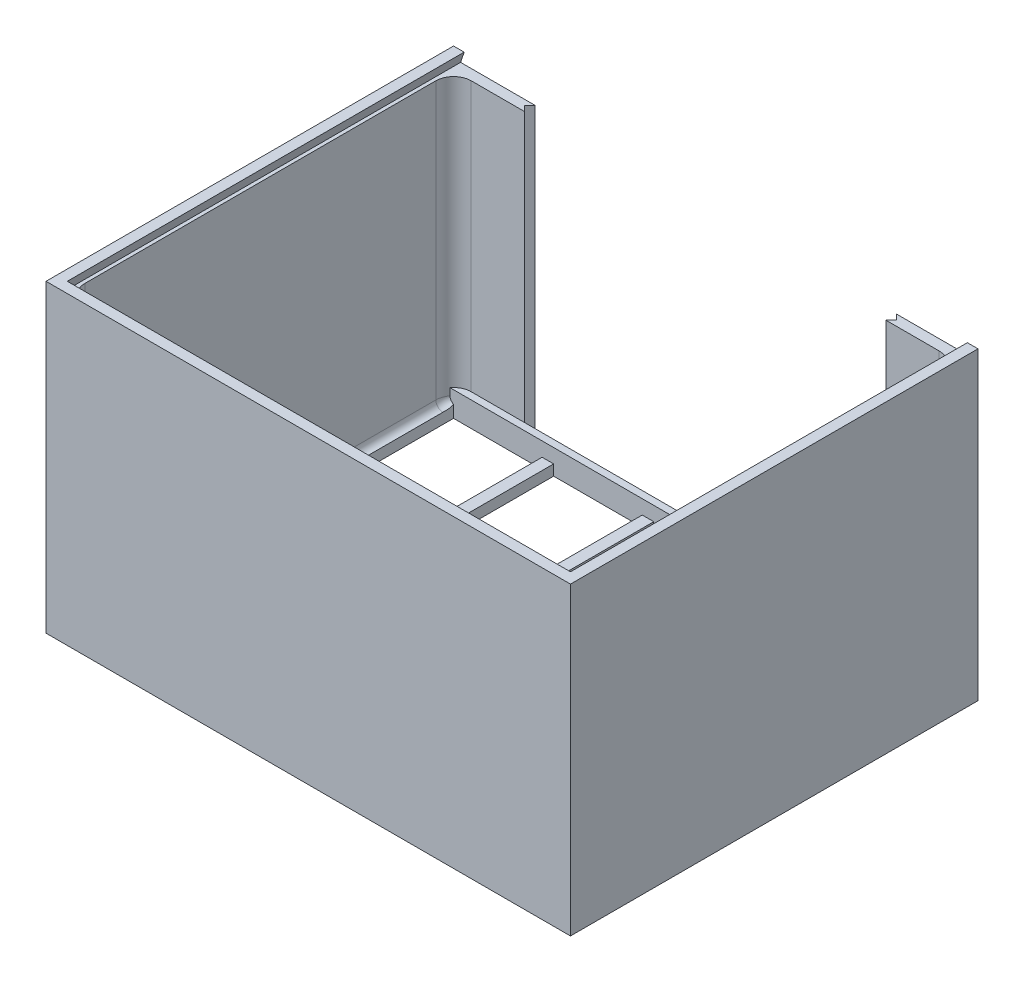
from build123d import *

# Parameters (mm, degrees)
SKETCH1_W                = 148
SKETCH1_H                = 115
SKETCH1_W_2              = 25
SKETCH1_H_2              = 24
BOSS_EXTRUDE2_DEPTH      = 3
BOSS_EXTRUDE3_DEPTH      = 80
SKETCH21_W               = 142
SKETCH21_H               = 2
BOSS_EXTRUDE9_DEPTH      = 4
BOSS_EXTRUDE7_DEPTH      = 8
BOSS_EXTRUDE7_DEPTH_BACK = 3
BOSS_EXTRUDE8_DEPTH      = 3
CUT_EXTRUDE1_DEPTH       = 112
FILLET1_R                = 5
FILLET2_R                = 2


with BuildPart() as part:
    # Sketch1 → Boss-Extrude2 (new body)
    with BuildSketch(Plane(origin=(0, 0, 0), x_dir=(1, 0, 0), z_dir=(0, 1, 0))):
        with Locations((69, 52.5)):
            Rectangle(SKETCH1_W, SKETCH1_H)
        with Locations((12.5, 66)):
            Rectangle(SKETCH1_W_2, SKETCH1_H_2, mode=Mode.SUBTRACT)
        with Locations((12.5, 39)):
            Rectangle(SKETCH1_W_2, SKETCH1_H_2, mode=Mode.SUBTRACT)
        with Locations((40.75, 66)):
            Rectangle(SKETCH1_W_2, SKETCH1_H_2, mode=Mode.SUBTRACT)
        with Locations((40.75, 39)):
            Rectangle(SKETCH1_W_2, SKETCH1_H_2, mode=Mode.SUBTRACT)
        with Locations((12.5, 12)):
            Rectangle(SKETCH1_W_2, SKETCH1_H_2, mode=Mode.SUBTRACT)
        with Locations((12.5, 93)):
            Rectangle(SKETCH1_W_2, SKETCH1_H_2, mode=Mode.SUBTRACT)
        with Locations((40.75, 12)):
            Rectangle(SKETCH1_W_2, SKETCH1_H_2, mode=Mode.SUBTRACT)
        with Locations((40.75, 93)):
            Rectangle(SKETCH1_W_2, SKETCH1_H_2, mode=Mode.SUBTRACT)
        with Locations((69, 66)):
            Rectangle(SKETCH1_W_2, SKETCH1_H_2, mode=Mode.SUBTRACT)
        with Locations((69, 39)):
            Rectangle(SKETCH1_W_2, SKETCH1_H_2, mode=Mode.SUBTRACT)
        with Locations((69, 12)):
            Rectangle(SKETCH1_W_2, SKETCH1_H_2, mode=Mode.SUBTRACT)
        with Locations((69, 93)):
            Rectangle(SKETCH1_W_2, SKETCH1_H_2, mode=Mode.SUBTRACT)
        with Locations((97.25, 66)):
            Rectangle(SKETCH1_W_2, SKETCH1_H_2, mode=Mode.SUBTRACT)
        with Locations((97.25, 39)):
            Rectangle(SKETCH1_W_2, SKETCH1_H_2, mode=Mode.SUBTRACT)
        with Locations((97.25, 12)):
            Rectangle(SKETCH1_W_2, SKETCH1_H_2, mode=Mode.SUBTRACT)
        with Locations((97.25, 93)):
            Rectangle(SKETCH1_W_2, SKETCH1_H_2, mode=Mode.SUBTRACT)
        with Locations((125.5, 66)):
            Rectangle(SKETCH1_W_2, SKETCH1_H_2, mode=Mode.SUBTRACT)
        with Locations((125.5, 39)):
            Rectangle(SKETCH1_W_2, SKETCH1_H_2, mode=Mode.SUBTRACT)
        with Locations((125.5, 12)):
            Rectangle(SKETCH1_W_2, SKETCH1_H_2, mode=Mode.SUBTRACT)
        with Locations((125.5, 93)):
            Rectangle(SKETCH1_W_2, SKETCH1_H_2, mode=Mode.SUBTRACT)
    extrude(amount=BOSS_EXTRUDE2_DEPTH)

    # Sketch4 → Boss-Extrude3 (add)
    with BuildSketch(Plane(origin=(0, 3, 0), x_dir=(1, 0, 0), z_dir=(0, 1, 0))):
        Polygon((-5, -5), (143, -5), (143, 110), (120, 110), (121.5, 108.5), (120, 107), (140, 107), (140, -2), (-2, -2), (-2, 107), (18, 107), (16.5, 108.5), (18, 110), (-5, 110), align=None)
    extrude(amount=BOSS_EXTRUDE3_DEPTH)

    # Sketch21 → Boss-Extrude9 (add)
    with BuildSketch(Plane(origin=(0, 3, 0), x_dir=(1, 0, 0), z_dir=(0, 1, 0))):
        with Locations((69, 106)):
            Rectangle(SKETCH21_W, SKETCH21_H)
    extrude(amount=BOSS_EXTRUDE9_DEPTH)

    # Sketch16 → Boss-Extrude7 (add, two sides: drawn at the far end of the back side and taken through both)
    with BuildSketch(Plane(origin=(0, 3, 0), x_dir=(1, 0, 0), z_dir=(0, 1, 0)).offset(-BOSS_EXTRUDE7_DEPTH_BACK)):
        with BuildLine():
            Line((5.5, 42), (-2, 42))
            Line((-2, 42), (-2, 38))
            Line((-2, 38), (5.5, 38))
            ThreePointArc((5.5, 38), (7.5, 40), (5.5, 42))
        make_face()
        with BuildLine():
            Line((140, 38), (132.5, 38))
            ThreePointArc((132.5, 38), (130.5, 40), (132.5, 42))
            Line((132.5, 42), (140, 42))
            Line((140, 42), (140, 38))
        make_face()
    extrude(amount=BOSS_EXTRUDE7_DEPTH + BOSS_EXTRUDE7_DEPTH_BACK)

    # Sketch17 → Boss-Extrude8 (add)
    with BuildSketch(Plane(origin=(0, 83, 0), x_dir=(1, 0, 0), z_dir=(0, 1, 0))):
        Polygon((-2, 110), (-5, 110), (-5, -5), (143, -5), (143, 110), (140, 110), (140, -2), (-2, -2), align=None)
    extrude(amount=BOSS_EXTRUDE8_DEPTH)

    # Sketch18 → Cut-Extrude1 (cut)
    with BuildSketch(Plane(origin=(0, 0, -110), x_dir=(-1, 0, 0), z_dir=(0, 0, -1))):
        Polygon((2, 86), (3, 83), (2, 83), align=None)
        Polygon((-140, 83), (-140, 86), (-141, 83), align=None)
    extrude(amount=-CUT_EXTRUDE1_DEPTH, mode=Mode.SUBTRACT)

    # Fillet1
    # the kernel refuses this fillet: 5 mm, written as the material it adds along each edge
    with BuildSketch(Plane(origin=(140, -5.5, -107), x_dir=(-1, 0, 0), z_dir=(0, 1, 0))) as fillet1_piece_1_section:
        with BuildLine():
            CenterArc((FILLET1_R, FILLET1_R), FILLET1_R, 180, 90)
            Line((0, FILLET1_R), (0, 0))
            Line((0, 0), (FILLET1_R, 0))
        make_face()
    fillet1_piece_1 = extrude(amount=88.5, mode=Mode.PRIVATE)
    fillet1_piece_1 = split(fillet1_piece_1, bisect_by=Plane(origin=(139.705950561, 3, -104.265828048), z_dir=(0, 1, 0)), keep=Keep.TOP, mode=Mode.PRIVATE)
    add(fillet1_piece_1)
    with BuildSketch(Plane(origin=(-2, -5.5, -107), x_dir=(0, 0, 1), z_dir=(0, 1, 0))) as fillet1_piece_2_section:
        with BuildLine():
            CenterArc((FILLET1_R, FILLET1_R), FILLET1_R, 180, 90)
            Line((0, FILLET1_R), (0, 0))
            Line((0, 0), (FILLET1_R, 0))
        make_face()
    fillet1_piece_2 = extrude(amount=88.5, mode=Mode.PRIVATE)
    fillet1_piece_2 = split(fillet1_piece_2, bisect_by=Plane(origin=(-1.705950561, 3, -104.265828048), z_dir=(0, 1, 0)), keep=Keep.TOP, mode=Mode.PRIVATE)
    add(fillet1_piece_2)
    with BuildSketch(Plane(origin=(140, 3, 2), x_dir=(-1, 0, 0), z_dir=(0, 1, 0)), Plane(origin=(-2, 3, 2), x_dir=(0, 0, -1), z_dir=(0, 1, 0))) as fillet1_piece_3:
        with BuildLine():
            CenterArc((FILLET1_R, -FILLET1_R), FILLET1_R, 90, 90)
            Line((0, -FILLET1_R), (0, 0))
            Line((0, 0), (FILLET1_R, 0))
        make_face()
    extrude(amount=80)

    # Fillet2
    # the kernel refuses this fillet: 2 mm, written as the material it adds along each edge
    with BuildSketch(Plane(origin=(135, 3, -102), x_dir=(-0.07270796920191176, 0, -0.9973532730254281), z_dir=(-0.9973532730254281, 0, 0.07270796920191176))) as fillet2_piece_1_section:
        with BuildLine():
            CenterArc((5 - FILLET2_R, -FILLET2_R), FILLET2_R, 0, 90)
            Line((5 - FILLET2_R, 0), (5, 0))
            Line((5, 0), (5, -FILLET2_R))
        make_face()
    fillet2_piece_1 = revolve(axis=Axis((135, 3, -102), (0, -1, 0)), revolution_arc=94.169538965, mode=Mode.PRIVATE)
    fillet2_piece_1 = split(fillet2_piece_1, bisect_by=Plane(origin=(138, 3.470530123, -106.266382325), z_dir=(-1, 0, 0)), keep=Keep.TOP, mode=Mode.PRIVATE)
    fillet2_piece_1 = split(fillet2_piece_1, bisect_by=Plane(origin=(136.35715758, 3.470530123, -105), z_dir=(0, 0, -1)), keep=Keep.TOP, mode=Mode.PRIVATE)
    add(fillet2_piece_1)
    with BuildSketch(Plane(origin=(135, 3, -102), x_dir=(-0.07270796920191176, 0, -0.9973532730254281), z_dir=(-0.9973532730254281, 0, 0.07270796920191176))) as fillet2_piece_2_section:
        with BuildLine():
            CenterArc((5 - FILLET2_R, -FILLET2_R), FILLET2_R, 0, 90)
            Line((5 - FILLET2_R, 0), (5, 0))
            Line((5, 0), (5, -FILLET2_R))
        make_face()
    fillet2_piece_2 = revolve(axis=Axis((135, 3, -102), (0, -1, 0)), revolution_arc=94.169538965, mode=Mode.PRIVATE)
    fillet2_piece_2 = split(fillet2_piece_2, bisect_by=Plane(origin=(138, 3.649157182, -105.409619708), z_dir=(1, 0, 0)), keep=Keep.TOP, mode=Mode.PRIVATE)
    fillet2_piece_2 = split(fillet2_piece_2, bisect_by=Plane(origin=(138.409619683, 3.649157182, -105), z_dir=(0, 0, -1)), keep=Keep.TOP, mode=Mode.PRIVATE)
    add(fillet2_piece_2)
    with BuildSketch(Plane(origin=(135, 3, -102), x_dir=(-0.07270796920191176, 0, -0.9973532730254281), z_dir=(-0.9973532730254281, 0, 0.07270796920191176))) as fillet2_piece_3_section:
        with BuildLine():
            CenterArc((5 - FILLET2_R, -FILLET2_R), FILLET2_R, 0, 90)
            Line((5 - FILLET2_R, 0), (5, 0))
            Line((5, 0), (5, -FILLET2_R))
        make_face()
    fillet2_piece_3 = revolve(axis=Axis((135, 3, -102), (0, -1, 0)), revolution_arc=94.169538965, mode=Mode.PRIVATE)
    fillet2_piece_3 = split(fillet2_piece_3, bisect_by=Plane(origin=(138, 3.469844762, -103.519186596), z_dir=(1, 0, 0)), keep=Keep.TOP, mode=Mode.PRIVATE)
    fillet2_piece_3 = split(fillet2_piece_3, bisect_by=Plane(origin=(139.232598195, 3.469844762, -105), z_dir=(0, 0, 1)), keep=Keep.TOP, mode=Mode.PRIVATE)
    add(fillet2_piece_3)
    with BuildSketch(Plane(origin=(135, 3, -3), x_dir=(0, 0, 1), z_dir=(-1, 0, 0))) as fillet2_piece_4_section:
        with BuildLine():
            CenterArc((5 - FILLET2_R, FILLET2_R), FILLET2_R, 270, 90)
            Line((5 - FILLET2_R, 0), (5, 0))
            Line((5, 0), (5, FILLET2_R))
        make_face()
    fillet2_piece_4 = revolve(axis=Axis((135, 3, -3), (0, 1, 0)), revolution_arc=90, mode=Mode.PRIVATE)
    fillet2_piece_4 = split(fillet2_piece_4, bisect_by=Plane(origin=(136.519186645, 3.469844745, 0), z_dir=(0, 0, 1)), keep=Keep.TOP, mode=Mode.PRIVATE)
    fillet2_piece_4 = split(fillet2_piece_4, bisect_by=Plane(origin=(138, 3.469844745, 1.232598019), z_dir=(-1, 0, 0)), keep=Keep.TOP, mode=Mode.PRIVATE)
    add(fillet2_piece_4)
    with BuildSketch(Plane(origin=(135, 3, -3), x_dir=(0, 0, 1), z_dir=(-1, 0, 0))) as fillet2_piece_5_section:
        with BuildLine():
            CenterArc((5 - FILLET2_R, FILLET2_R), FILLET2_R, 270, 90)
            Line((5 - FILLET2_R, 0), (5, 0))
            Line((5, 0), (5, FILLET2_R))
        make_face()
    fillet2_piece_5 = revolve(axis=Axis((135, 3, -3), (0, 1, 0)), revolution_arc=90, mode=Mode.PRIVATE)
    fillet2_piece_5 = split(fillet2_piece_5, bisect_by=Plane(origin=(138.409619683, 3.649157182, 0), z_dir=(0, 0, 1)), keep=Keep.TOP, mode=Mode.PRIVATE)
    fillet2_piece_5 = split(fillet2_piece_5, bisect_by=Plane(origin=(138, 3.649157182, 0.409619708), z_dir=(1, 0, 0)), keep=Keep.TOP, mode=Mode.PRIVATE)
    add(fillet2_piece_5)
    with BuildSketch(Plane(origin=(135, 3, -3), x_dir=(0, 0, 1), z_dir=(-1, 0, 0))) as fillet2_piece_6_section:
        with BuildLine():
            CenterArc((5 - FILLET2_R, FILLET2_R), FILLET2_R, 270, 90)
            Line((5 - FILLET2_R, 0), (5, 0))
            Line((5, 0), (5, FILLET2_R))
        make_face()
    fillet2_piece_6 = revolve(axis=Axis((135, 3, -3), (0, 1, 0)), revolution_arc=90, mode=Mode.PRIVATE)
    fillet2_piece_6 = split(fillet2_piece_6, bisect_by=Plane(origin=(139.232598178, 3.469844758, 0), z_dir=(0, 0, -1)), keep=Keep.TOP, mode=Mode.PRIVATE)
    fillet2_piece_6 = split(fillet2_piece_6, bisect_by=Plane(origin=(138, 3.469844758, -1.480813405), z_dir=(1, 0, 0)), keep=Keep.TOP, mode=Mode.PRIVATE)
    add(fillet2_piece_6)
    with BuildSketch(Plane(origin=(3, 3, -3), x_dir=(-1, 0, 0), z_dir=(0, 0, -1))) as fillet2_piece_7_section:
        with BuildLine():
            CenterArc((5 - FILLET2_R, FILLET2_R), FILLET2_R, 270, 90)
            Line((5 - FILLET2_R, 0), (5, 0))
            Line((5, 0), (5, FILLET2_R))
        make_face()
    fillet2_piece_7 = revolve(axis=Axis((3, 3, -3), (0, 1, 0)), revolution_arc=90, mode=Mode.PRIVATE)
    fillet2_piece_7 = split(fillet2_piece_7, bisect_by=Plane(origin=(0, 3.469844745, -1.480813355), z_dir=(-1, 0, 0)), keep=Keep.TOP, mode=Mode.PRIVATE)
    fillet2_piece_7 = split(fillet2_piece_7, bisect_by=Plane(origin=(-1.232598019, 3.469844745, 0), z_dir=(0, 0, -1)), keep=Keep.TOP, mode=Mode.PRIVATE)
    add(fillet2_piece_7)
    with BuildSketch(Plane(origin=(3, 3, -3), x_dir=(-1, 0, 0), z_dir=(0, 0, -1))) as fillet2_piece_8_section:
        with BuildLine():
            CenterArc((5 - FILLET2_R, FILLET2_R), FILLET2_R, 270, 90)
            Line((5 - FILLET2_R, 0), (5, 0))
            Line((5, 0), (5, FILLET2_R))
        make_face()
    fillet2_piece_8 = revolve(axis=Axis((3, 3, -3), (0, 1, 0)), revolution_arc=90, mode=Mode.PRIVATE)
    fillet2_piece_8 = split(fillet2_piece_8, bisect_by=Plane(origin=(0, 3.649157182, 0.409619683), z_dir=(-1, 0, 0)), keep=Keep.TOP, mode=Mode.PRIVATE)
    fillet2_piece_8 = split(fillet2_piece_8, bisect_by=Plane(origin=(-0.409619708, 3.649157182, 0), z_dir=(0, 0, 1)), keep=Keep.TOP, mode=Mode.PRIVATE)
    add(fillet2_piece_8)
    with BuildSketch(Plane(origin=(3, 3, -3), x_dir=(-1, 0, 0), z_dir=(0, 0, -1))) as fillet2_piece_9_section:
        with BuildLine():
            CenterArc((5 - FILLET2_R, FILLET2_R), FILLET2_R, 270, 90)
            Line((5 - FILLET2_R, 0), (5, 0))
            Line((5, 0), (5, FILLET2_R))
        make_face()
    fillet2_piece_9 = revolve(axis=Axis((3, 3, -3), (0, 1, 0)), revolution_arc=90, mode=Mode.PRIVATE)
    fillet2_piece_9 = split(fillet2_piece_9, bisect_by=Plane(origin=(0, 3.469844758, 1.232598178), z_dir=(1, 0, 0)), keep=Keep.TOP, mode=Mode.PRIVATE)
    fillet2_piece_9 = split(fillet2_piece_9, bisect_by=Plane(origin=(1.480813405, 3.469844758, 0), z_dir=(0, 0, 1)), keep=Keep.TOP, mode=Mode.PRIVATE)
    add(fillet2_piece_9)
    with BuildSketch(Plane(origin=(3, 3, -102), x_dir=(-1, 0, 0), z_dir=(0, 0, 1))) as fillet2_piece_10_section:
        with BuildLine():
            CenterArc((5 - FILLET2_R, -FILLET2_R), FILLET2_R, 0, 90)
            Line((5 - FILLET2_R, 0), (5, 0))
            Line((5, 0), (5, -FILLET2_R))
        make_face()
    fillet2_piece_10 = revolve(axis=Axis((3, 3, -102), (0, -1, 0)), revolution_arc=94.169538965, mode=Mode.PRIVATE)
    fillet2_piece_10 = split(fillet2_piece_10, bisect_by=Plane(origin=(0, 3.469844744, -103.519186642), z_dir=(-1, 0, 0)), keep=Keep.TOP, mode=Mode.PRIVATE)
    fillet2_piece_10 = split(fillet2_piece_10, bisect_by=Plane(origin=(-1.232598016, 3.469844744, -105), z_dir=(0, 0, 1)), keep=Keep.TOP, mode=Mode.PRIVATE)
    add(fillet2_piece_10)
    with BuildSketch(Plane(origin=(3, 3, -102), x_dir=(-1, 0, 0), z_dir=(0, 0, 1))) as fillet2_piece_11_section:
        with BuildLine():
            CenterArc((5 - FILLET2_R, -FILLET2_R), FILLET2_R, 0, 90)
            Line((5 - FILLET2_R, 0), (5, 0))
            Line((5, 0), (5, -FILLET2_R))
        make_face()
    fillet2_piece_11 = revolve(axis=Axis((3, 3, -102), (0, -1, 0)), revolution_arc=94.169538965, mode=Mode.PRIVATE)
    fillet2_piece_11 = split(fillet2_piece_11, bisect_by=Plane(origin=(0, 3.649157182, -105.409619683), z_dir=(-1, 0, 0)), keep=Keep.TOP, mode=Mode.PRIVATE)
    fillet2_piece_11 = split(fillet2_piece_11, bisect_by=Plane(origin=(-0.409619708, 3.649157182, -105), z_dir=(0, 0, -1)), keep=Keep.TOP, mode=Mode.PRIVATE)
    add(fillet2_piece_11)
    with BuildSketch(Plane(origin=(3, 3, -102), x_dir=(-1, 0, 0), z_dir=(0, 0, 1))) as fillet2_piece_12_section:
        with BuildLine():
            CenterArc((5 - FILLET2_R, -FILLET2_R), FILLET2_R, 0, 90)
            Line((5 - FILLET2_R, 0), (5, 0))
            Line((5, 0), (5, -FILLET2_R))
        make_face()
    fillet2_piece_12 = revolve(axis=Axis((3, 3, -102), (0, -1, 0)), revolution_arc=94.169538965, mode=Mode.PRIVATE)
    fillet2_piece_12 = split(fillet2_piece_12, bisect_by=Plane(origin=(0, 3.470530119, -106.266382366), z_dir=(1, 0, 0)), keep=Keep.TOP, mode=Mode.PRIVATE)
    fillet2_piece_12 = split(fillet2_piece_12, bisect_by=Plane(origin=(1.642842463, 3.470530119, -105), z_dir=(0, 0, -1)), keep=Keep.TOP, mode=Mode.PRIVATE)
    add(fillet2_piece_12)
    with BuildSketch(Plane(origin=(140, 3, -102), x_dir=(-1, 0, 0), z_dir=(0, 0, 1))) as fillet2_piece_13:
        with BuildLine():
            CenterArc((FILLET2_R, -FILLET2_R), FILLET2_R, 90, 90)
            Line((0, -FILLET2_R), (0, 0))
            Line((0, 0), (FILLET2_R, 0))
        make_face()
    extrude(amount=65)
    with BuildSketch(Plane(origin=(140, 3, -43), x_dir=(-1, 0, 0), z_dir=(0, 0, 1))) as fillet2_piece_14:
        with BuildLine():
            CenterArc((FILLET2_R, -FILLET2_R), FILLET2_R, 90, 90)
            Line((0, -FILLET2_R), (0, 0))
            Line((0, 0), (FILLET2_R, 0))
        make_face()
    extrude(amount=40)
    with BuildSketch(Plane(origin=(135, 3, 2), x_dir=(0, 0, -1), z_dir=(-1, 0, 0))) as fillet2_piece_15:
        with BuildLine():
            CenterArc((FILLET2_R, -FILLET2_R), FILLET2_R, 90, 90)
            Line((0, -FILLET2_R), (0, 0))
            Line((0, 0), (FILLET2_R, 0))
        make_face()
    extrude(amount=132)
    with BuildSketch(Plane(origin=(-2, 3, -3), x_dir=(0, 1, 0), z_dir=(0, 0, -1))) as fillet2_piece_16:
        with BuildLine():
            CenterArc((FILLET2_R, FILLET2_R), FILLET2_R, 180, 90)
            Line((0, FILLET2_R), (0, 0))
            Line((0, 0), (FILLET2_R, 0))
        make_face()
    extrude(amount=40)
    with BuildSketch(Plane(origin=(-2, 3, -37), x_dir=(0, 1, 0), z_dir=(0, 0, -1))) as fillet2_piece_17:
        with BuildLine():
            CenterArc((FILLET2_R, FILLET2_R), FILLET2_R, 180, 90)
            Line((0, FILLET2_R), (0, 0))
            Line((0, 0), (FILLET2_R, 0))
        make_face()
    extrude(amount=65)


solid = part.part
